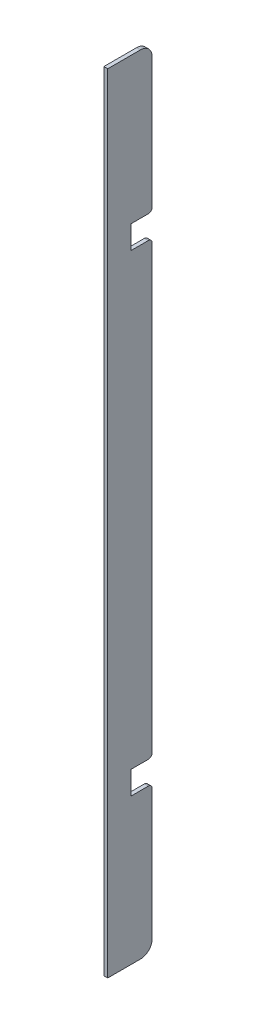
from build123d import *

# Parameters (mm, degrees)
BOSS_EXTRUDE1_DEPTH = 1
CUT_EXTRUDE1_DEPTH  = 113.312065247


with BuildPart() as part:
    # Sketch1 → Boss-Extrude1 (new body)
    with BuildSketch(Plane(origin=(-48, 0, 0), x_dir=(0, -1, 0), z_dir=(-1, 0, 0))):
        with BuildLine():
            Line((-99, -47), (99, -47))
            ThreePointArc((99, -47), (101.121320344, -46.121320344), (102, -44))
            Line((102, -44), (102, -35.5))
            Line((102, -35.5), (-102, -35.5))
            Line((-102, -35.5), (-102, -44))
            ThreePointArc((-102, -44), (-101.121320344, -46.121320344), (-99, -47))
        make_face()
    extrude(amount=-BOSS_EXTRUDE1_DEPTH)

    # Sketch2 → Cut-Extrude1 (cut, through all)
    with BuildSketch(Plane(origin=(-47, 0, 0), x_dir=(0, 0, -1), z_dir=(1, 0, 0))):
        with BuildLine():
            Line((41.5, 64.2), (46, 64.2))
            ThreePointArc((46, 64.2), (46.707106781, 64.492893219), (47, 65.2))
            Line((47, 65.2), (47, 57.2))
            ThreePointArc((47, 57.2), (46.707106781, 57.907106781), (46, 58.2))
            Line((46, 58.2), (41.5, 58.2))
            Line((41.5, 58.2), (41.5, 64.2))
        make_face()
        with BuildLine():
            Line((41.5, -64.2), (46, -64.2))
            ThreePointArc((46, -64.2), (46.707106781, -64.492893219), (47, -65.2))
            Line((47, -65.2), (47, -57.2))
            ThreePointArc((47, -57.2), (46.707106781, -57.907106781), (46, -58.2))
            Line((46, -58.2), (41.5, -58.2))
            Line((41.5, -58.2), (41.5, -64.2))
        make_face()
    extrude(amount=-CUT_EXTRUDE1_DEPTH, mode=Mode.SUBTRACT)


solid = part.part
